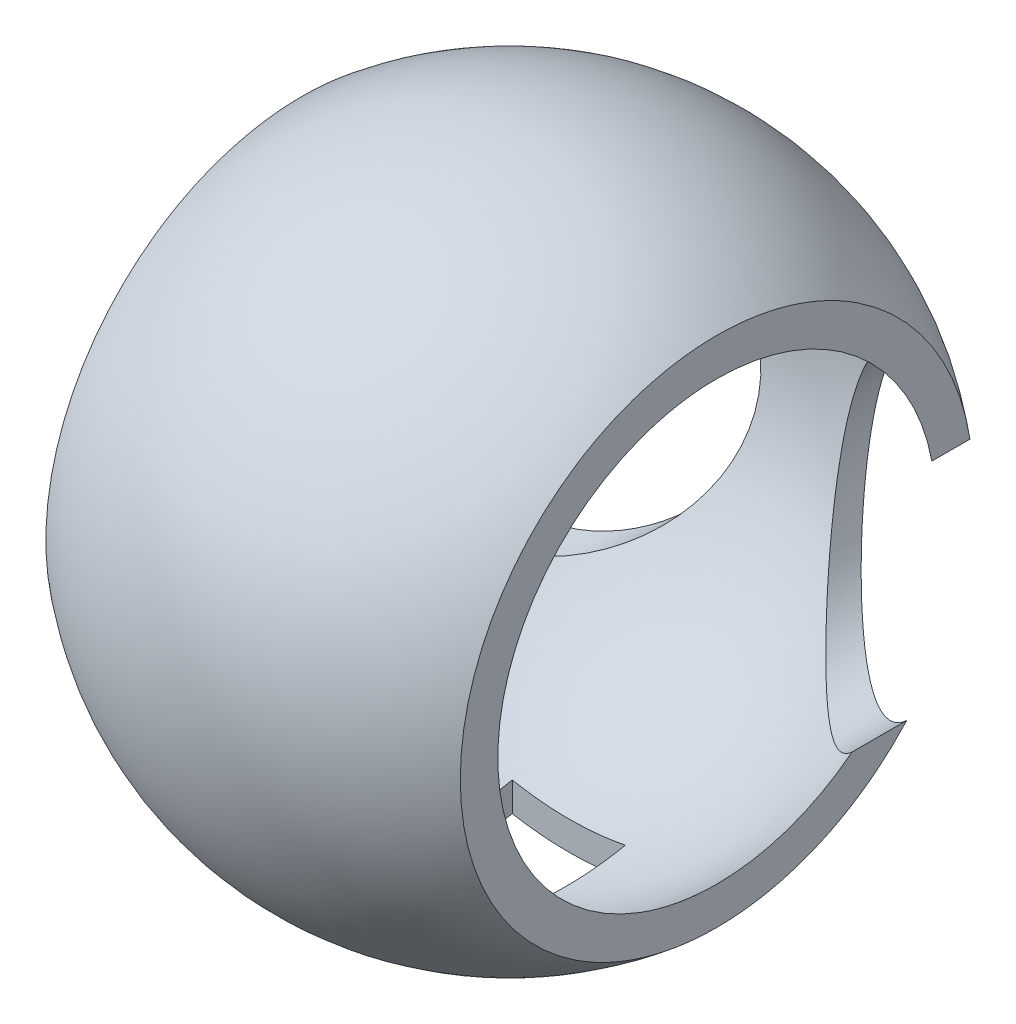
from build123d import *

# Parameters (mm, degrees)
CORTAR_EXTRUIR1_DEPTH      = 29.000000000000004
CORTAR_EXTRUIR1_DEPTH_BACK = 28.999999999999996
VACIADO2_T                 = -3
CROQUIS3_RX                = 14
CROQUIS3_RY                = 11
CROQUIS3_RX_2              = 13.999999999999996
CORTAR_EXTRUIR2_DEPTH      = 36.00000000000001
CORTAR_EXTRUIR5_DEPTH      = 40.000000000000014


with BuildPart() as part:
    # Croquis1 → Revolución1 (revolve)
    with BuildSketch(Plane.XY):
        with BuildLine():
            Line((0, 35.00000000000001), (0, -35.00000000000001))
            ThreePointArc((0, -35.00000000000001), (35.00000000000001, 0), (0, 35.00000000000001))
        make_face()
    revolve(axis=Axis((0, 35.00000000000001, 0), (0, -1, 0)))

    # Croquis2 → Cortar-Extruir1 (cut, two sides: drawn at the far end of the back side and taken through both)
    with BuildSketch(Plane.XY.offset(-CORTAR_EXTRUIR1_DEPTH_BACK)):
        Polygon((35.00000000000001, -30.702641270743), (35.00000000000001, 29.209930144828903), (22.000000000000014, 29.209930144828906), (22.000000000000014, -30.702641270742998), align=None)
        Polygon((-36.52578998495032, -30.702641270743), (-22.000000000000014, -30.702641270743), (-22.000000000000014, 0), (-22.000000000000014, 29.209930144828903), (-36.52578998495032, 29.209930144828906), align=None)
    extrude(amount=CORTAR_EXTRUIR1_DEPTH + CORTAR_EXTRUIR1_DEPTH_BACK, mode=Mode.SUBTRACT)

    # Vaciado2
    vaciado2_openings = [part.faces().sort_by_distance(p)[0] for p in [
        (22, 0, 0),
        (-22, 0, 0),
    ]]
    offset(amount=VACIADO2_T, openings=vaciado2_openings)

    # Croquis3 → Cortar-Extruir2 (cut)
    with BuildSketch(Plane.XY):
        with Locations(Location((-15.45739609156445, -7.052178265058588), (0, 0, 90))):
            Ellipse(CROQUIS3_RX, CROQUIS3_RY)
        with Locations(Location((15.457396091564462, -7.013044566264646), (0, 0, -90))):
            Ellipse(CROQUIS3_RX_2, CROQUIS3_RY)
    extrude(amount=-CORTAR_EXTRUIR2_DEPTH, mode=Mode.SUBTRACT)

    # Croquis4 → Cortar-Extruir5 (cut)
    with BuildSketch(Plane(origin=(0, 0, 0), x_dir=(1, 0, 0), z_dir=(0, 1, 0))):
        Polygon((6, 6.296978304127384), (-6, 6.296978304127383), (-6, -15.6), (6.0000000000000036, -15.6), align=None)
    extrude(amount=-CORTAR_EXTRUIR5_DEPTH, mode=Mode.SUBTRACT)


solid = part.part
